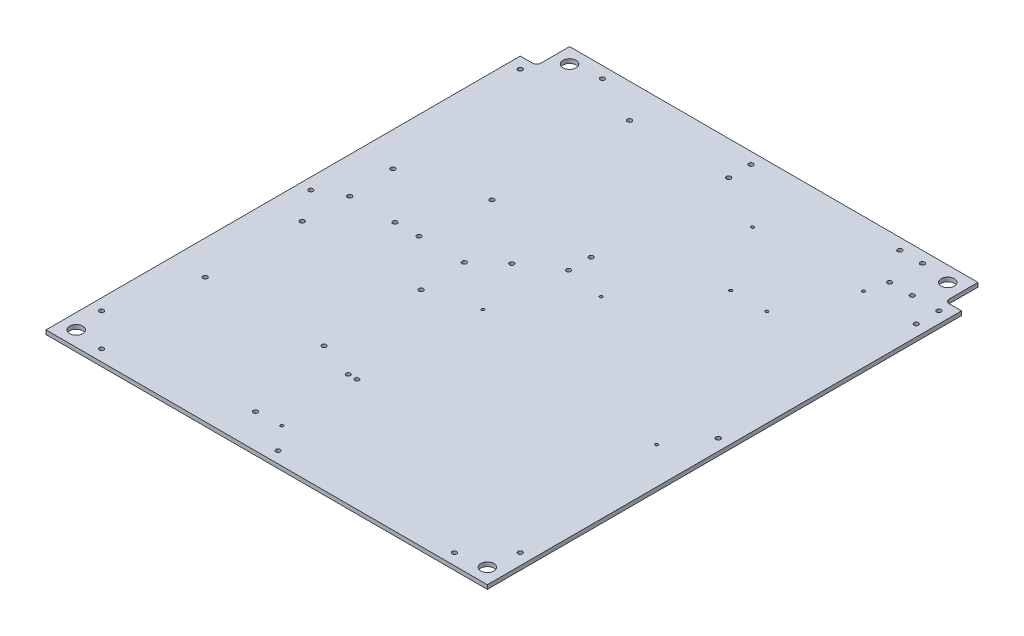
from build123d import *

# Parameters (mm, degrees)
SKETCH1_W                 = 340.868
SKETCH1_H                 = 391.668
BOSS_EXTRUDE1_DEPTH       = 3.175
CUT_EXTRUDE1_DEPTH        = 10
F_3_8_CLEARANCE_HOLE1_D   = 10.0838
F_4_40_TAPPED_HOLE2_D     = 2.2606
F_8_32_TAPPED_HOLE2_D     = 3.4544
F_4_CLEARANCE_HOLE1_D     = 3.2639
F_4_CLEARANCE_HOLE1_DEPTH = 8.01
F_4_CLEARANCE_HOLE1_TIP   = 0.980574487


with BuildPart() as part:
    # Sketch1 → Boss-Extrude1 (new body)
    with BuildSketch(Plane(origin=(0, 0, 0), x_dir=(1, 0, 0), z_dir=(0, 1, 0))):
        Rectangle(SKETCH1_W, SKETCH1_H)
    extrude(amount=BOSS_EXTRUDE1_DEPTH)

    # Sketch2 → Cut-Extrude1 (cut)
    with BuildSketch(Plane(origin=(0, 3.175, 0), x_dir=(1, 0, 0), z_dir=(0, 1, 0))):
        with BuildLine():
            Line((-170.434, 195.834), (-157.734, 195.834))
            Line((-157.734, 195.834), (-157.734, 173.609))
            ThreePointArc((-157.734, 173.609), (-158.66393597, 171.36393597), (-160.909, 170.434))
            Line((-160.909, 170.434), (-170.434, 170.434))
            Line((-170.434, 170.434), (-170.434, 195.834))
        make_face()
        with BuildLine():
            Line((170.434, 195.834), (157.734, 195.834))
            Line((157.734, 195.834), (157.734, 173.609))
            ThreePointArc((157.734, 173.609), (158.66393597, 171.36393597), (160.909, 170.434))
            Line((160.909, 170.434), (170.434, 170.434))
            Line((170.434, 170.434), (170.434, 195.834))
        make_face()
    extrude(amount=-CUT_EXTRUDE1_DEPTH, mode=Mode.SUBTRACT)

    # 3/8 Clearance Hole1 (through all)
    with Locations(Plane(origin=(0, 3.175, 0), x_dir=(1, 0, 0), z_dir=(0, 1, 0))):
        with Locations((158.75, -184.15), (-158.75, -184.15), (-146.05, 184.15), (146.05, 184.15)):
            Hole(F_3_8_CLEARANCE_HOLE1_D / 2)

    # #4-40 Tapped Hole2 (through all)
    with Locations(Plane(origin=(0, 3.175, 0), x_dir=(1, 0, 0), z_dir=(0, 1, 0))):
        with Locations((119.375, 145.759), (33.725, 145.759), (21.73, 40.754), (67.7, 94.894), (95.6, 94.894), (-15.34, -13.51), (142.14, -36.73), (-15.34, -168.81)):
            Hole(F_4_40_TAPPED_HOLE2_D / 2)

    # #8-32 Tapped Hole2 (through all)
    with Locations(Plane(origin=(0, 3.175, 0), x_dir=(1, 0, 0), z_dir=(0, 1, 0))):
        with Locations((-161.684, -161.684), (-161.684, 0), (-161.684, 161.684), (-144.184, 45.834), (-8.584, 45.834), (-144.184, -24.166), (-52.384, -24.166), (-144.184, -99.166), (-52.384, -99.166), (-34.884, 28.334), (-34.884, -169.584), (-136.284, -187.084), (0, -187.084), (136.284, -187.084), (161.684, -161.684), (161.684, -8.75), (161.684, 144.184), (141.084, 161.684), (161.684, 161.684), (123.584, 161.684), (123.584, 187.084), (106.084, 187.084), (-123.584, 187.084), (-8.75, 187.084), (-8.584, 169.584), (-8.584, 63.334), (-142.534, 10.834), (-107.534, 10.834), (-89.034, 10.834), (-54.034, 10.834), (-85.134, 63.334), (-85.134, 169.584)):
            Hole(F_8_32_TAPPED_HOLE2_D / 2)

    # #4 Clearance Hole1
    with Locations(Plane(origin=(0, 3.175, 0), x_dir=(1, 0, 0), z_dir=(0, 1, 0))):
        with Locations((-23.925625, -108.8644), (-17.274375, -108.8644)):
            Hole(F_4_CLEARANCE_HOLE1_D / 2, depth=F_4_CLEARANCE_HOLE1_DEPTH)
            with Locations((0, 0, -(F_4_CLEARANCE_HOLE1_DEPTH + F_4_CLEARANCE_HOLE1_TIP / 2))):  # 118° drill point
                Cone(0, F_4_CLEARANCE_HOLE1_D / 2, F_4_CLEARANCE_HOLE1_TIP, mode=Mode.SUBTRACT)


solid = part.part
